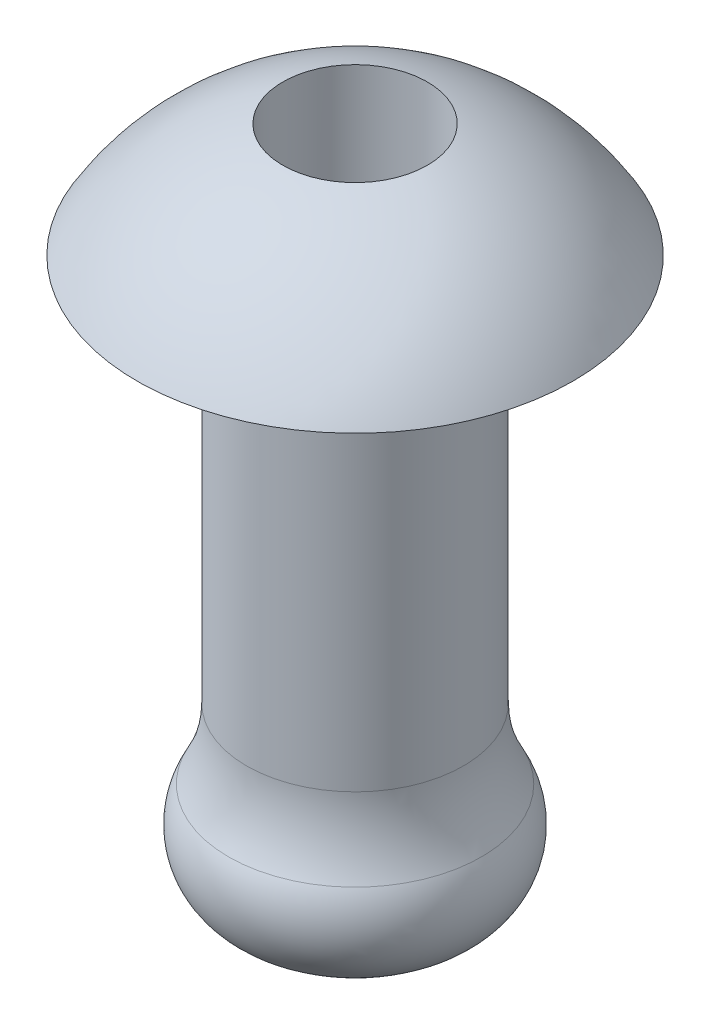
from build123d import *
from build123d.topology import SkipClean

# Parameters (mm, degrees)
SKETCH_2_R          = 1
CUT_EXTRUDE_1_DEPTH = 50
SKETCH_3_W          = 30
SKETCH_3_H          = 1.543001366
CUT_EXTRUDE_2_DEPTH = 5
FILLET_1_R          = 1


with BuildPart() as part:
    # 草图1 → 旋转1 (revolve)
    with SkipClean():  # the faces are left unmerged after this step: merging them gives an invalid solid
        with BuildSketch(Plane.XY):
            with BuildLine():
                Line((-57.054109227, 42.647640507), (-58.554109227, 42.647640507))
                Line((-58.554109227, 42.647640507), (-58.554109227, 33.247028335))
                ThreePointArc((-58.554109227, 33.247028335), (-56.797365364, 34.258679156), (-56.790595512, 36.285879333))
                ThreePointArc((-56.790595512, 36.285879333), (-56.987108525, 36.764821339), (-57.054109227, 37.278157209))
                Line((-57.054109227, 37.278157209), (-57.054109227, 42.647640507))
            make_face()
            with BuildLine():
                ThreePointArc((-58.554109227, 44.37170043), (-60.291090766, 43.910268372), (-61.570072895, 42.647640507))
                Line((-61.570072895, 42.647640507), (-60.054109227, 42.647640507))
                Line((-60.054109227, 42.647640507), (-58.554109227, 42.647640507))
                Line((-58.554109227, 42.647640507), (-58.554109227, 44.37170043))
            make_face()
            with BuildLine():
                ThreePointArc((-55.53814556, 42.647640507), (-56.817127689, 43.910268372), (-58.554109227, 44.37170043))
                Line((-58.554109227, 44.37170043), (-58.554109227, 42.647640507))
                Line((-58.554109227, 42.647640507), (-57.054109227, 42.647640507))
                Line((-57.054109227, 42.647640507), (-55.53814556, 42.647640507))
            make_face()
        revolve(axis=Axis((-58.554109227, 44.37170043, 0), (0, -1, 0)))
    add(part.part.scale(1), mode=Mode.REPLACE)  # the faces are merged on a copy

    # 草图2 → 切除-拉伸1 (cut)
    with BuildSketch(Plane(origin=(0, 0, 0), x_dir=(1, 0, 0), z_dir=(0, 1, 0))):
        with Locations((-58.554109227, 0)):
            Circle(SKETCH_2_R)
    extrude(amount=CUT_EXTRUDE_1_DEPTH, mode=Mode.SUBTRACT)

    # 草图3 → 切除-拉伸2 (cut, symmetric)
    with BuildSketch(Plane.XY):
        with Locations((-45.847587109, 34.065831969)):
            Rectangle(SKETCH_3_W, SKETCH_3_H)
    extrude(amount=CUT_EXTRUDE_2_DEPTH, both=True, mode=Mode.SUBTRACT)

    # 圆角1
    # the kernel refuses this fillet: 1 mm, written as the material it takes off along each edge
    with BuildSketch(Plane(origin=(-58.554109227, 34.837332652, 0), x_dir=(1, 0, 0), z_dir=(0, 0, 1))) as fillet_1_piece_1:
        with BuildLine():
            CenterArc((0.873089514, 0.991914174), FILLET_1_R, 277.291097339, 111.588468761)
            Line((1.748726343, 1.474884302), (1.836290026, 1.523181315))
            ThreePointArc((1.836290026, 1.523181315), (1.85033803, 1.498160575), (2.080331258, -0.021703426))
            Line((2.080331258, -0.021703426), (1.982714859, -0.1))
            ThreePointArc((1.982714859, -0.1), (1.49135743, -0.1), (1.012691049, -0.099191417))
            Line((1.012691049, -0.099191417), (1, 0))
        make_face()
    revolve(axis=Axis((-58.554109227, 34.837332652, 0), (0, 1, 0)), mode=Mode.SUBTRACT)


solid = part.part
